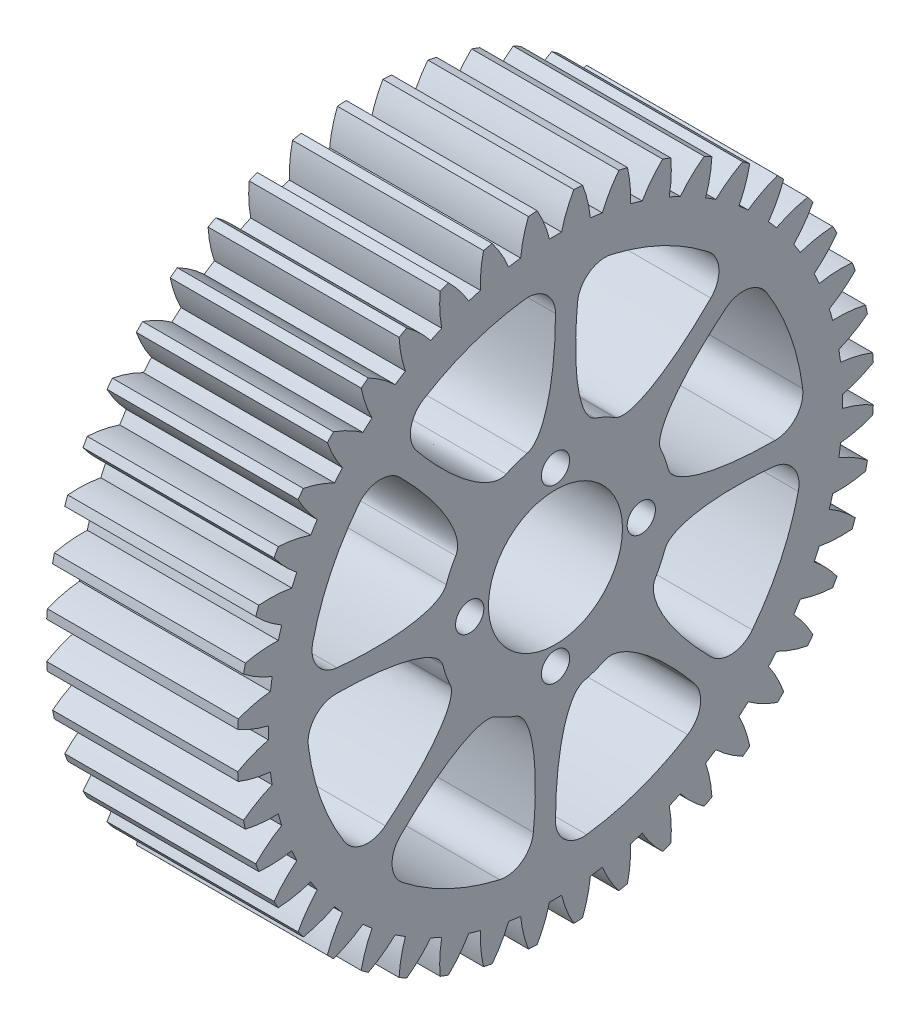
from build123d import *
from build123d.topology import SkipClean

# Parameters (mm, degrees)
BASPROSKE_W        = 44.5
BASPROSKE_H        = 57.5
TOOTHCUT_DEPTH     = 93.697087333
TEETHCUTS_COUNT    = 44
TEETHCUTS_ANGLE    = 351.818181818
HUBNEAONESKE_R     = 21
HUBNEARONE_DEPTH   = 5.5000508
BORSKE_R           = 12
BORE_DEPTH         = 50.0000508
CUT_EXTRUDE1_DEPTH = 93.578937397
FILLET4_R          = 5
SKETCH6_R          = 57.5
CUT_EXTRUDE2_DEPTH = 10
SKETCH7_R          = 12.1
CUT_EXTRUDE3_DEPTH = 91.502009572
SKETCH8_R          = 2.55
CUT_EXTRUDE4_DEPTH = 91.502009572
CIRPATTERN1_COUNT  = 4


with BuildPart() as part:
    # BasProSke → Base-Revolve (revolve)
    with BuildSketch(Plane(origin=(0, 0, 0), x_dir=(1, 0, 0), z_dir=(0, 1, 0)), mode=Mode.PRIVATE) as base_revolve_sk:
        with Locations((22.25, 28.75)):
            Rectangle(BASPROSKE_W, BASPROSKE_H)
    revolve(base_revolve_sk.sketch.rotate(Axis((-10, 0, 0), (1, 0, 0)), 180), axis=Axis((-10, 0, 0), (1, 0, 0)))

    # TooCutSke → ToothCut (cut, through all)
    with BuildSketch(Plane(origin=(0, 0, 0), x_dir=(0, 0, -1), z_dir=(1, 0, 0))):
        with BuildLine():
            ThreePointArc((1.096427316, 51.862411467), (0, 51.874), (-1.096427316, 51.862411467))
            ThreePointArc((-1.096427316, 51.862411467), (-2.018853505, 54.722077315), (-3.322337066, 57.429380299))
            ThreePointArc((-3.322337066, 57.429380299), (0, 57.5254), (3.322337066, 57.429380299))
            ThreePointArc((3.322337066, 57.429380299), (2.018853505, 54.722077315), (1.096427316, 51.862411467))
        make_face()
    toothcut = extrude(amount=TOOTHCUT_DEPTH, mode=Mode.SUBTRACT)

    # TeethCuts: ToothCut ×44 about axis
    teethcuts_axis = Axis((-10, 0, 0), (1, 0, 0))
    for i in range(1, TEETHCUTS_COUNT):
        add(toothcut.rotate(teethcuts_axis, i * TEETHCUTS_ANGLE / (TEETHCUTS_COUNT - 1)), mode=Mode.SUBTRACT)

    # HubNeaOneSke → HubNearOne (add)
    with BuildSketch(Plane.ZY):
        with Locations(Location((0, 0, 0), (0, 0, 180))):
            Circle(HUBNEAONESKE_R)
    extrude(amount=HUBNEARONE_DEPTH)

    # BorSke → Bore (cut, symmetric)
    with BuildSketch(Plane(origin=(0, 0, 0), x_dir=(0, 0, -1), z_dir=(1, 0, 0))):
        with Locations(Location((0, 0, 0), (0, 0, 180))):
            Circle(BORSKE_R)
    extrude(amount=BORE_DEPTH, both=True, mode=Mode.SUBTRACT)

    # Sketch5 → Cut-Extrude1 (cut, through all)
    with SkipClean():  # the faces are left unmerged after this step: merging them gives an invalid solid
        with BuildSketch(Plane.ZY):
            with BuildLine():
                Line((0, 21), (0, 45))
                ThreePointArc((0, 45), (15.100954119, 42.390578961), (28.450586133, 34.864941541))
                Line((28.450586133, 34.864941541), (13.276940195, 16.270306053))
                ThreePointArc((13.276940195, 16.270306053), (7.047111922, 19.782270182), (0, 21))
            make_face()
            with BuildLine():
                Line((14.849242405, 14.849242405), (31.819805153, 31.819805153))
                ThreePointArc((31.819805153, 31.819805153), (40.652652902, 19.296678782), (44.770838973, 4.535634206))
                Line((44.770838973, 4.535634206), (20.893058187, 2.116629296))
                ThreePointArc((20.893058187, 2.116629296), (18.971238021, 9.005116765), (14.849242405, 14.849242405))
            make_face()
            with BuildLine():
                Line((21, 0), (45, 0))
                ThreePointArc((45, 0), (42.390578961, -15.100954119), (34.864941541, -28.450586133))
                Line((34.864941541, -28.450586133), (16.270306053, -13.276940195))
                ThreePointArc((16.270306053, -13.276940195), (19.782270182, -7.047111922), (21, 0))
            make_face()
            with BuildLine():
                Line((14.849242405, -14.849242405), (31.819805153, -31.819805153))
                ThreePointArc((31.819805153, -31.819805153), (19.296678782, -40.652652902), (4.535634206, -44.770838973))
                Line((4.535634206, -44.770838973), (2.116629296, -20.893058187))
                ThreePointArc((2.116629296, -20.893058187), (9.005116765, -18.971238021), (14.849242405, -14.849242405))
            make_face()
            with BuildLine():
                Line((0, -21), (0, -45))
                ThreePointArc((0, -45), (-15.100954119, -42.390578961), (-28.450586133, -34.864941541))
                Line((-28.450586133, -34.864941541), (-13.276940195, -16.270306053))
                ThreePointArc((-13.276940195, -16.270306053), (-7.047111922, -19.782270182), (0, -21))
            make_face()
            with BuildLine():
                Line((-14.849242405, -14.849242405), (-31.819805153, -31.819805153))
                ThreePointArc((-31.819805153, -31.819805153), (-40.652652902, -19.296678782), (-44.770838973, -4.535634206))
                Line((-44.770838973, -4.535634206), (-20.893058187, -2.116629296))
                ThreePointArc((-20.893058187, -2.116629296), (-18.971238021, -9.005116765), (-14.849242405, -14.849242405))
            make_face()
            with BuildLine():
                Line((-21, 0), (-45, 0))
                ThreePointArc((-45, 0), (-42.390578961, 15.100954119), (-34.864941541, 28.450586133))
                Line((-34.864941541, 28.450586133), (-16.270306053, 13.276940195))
                ThreePointArc((-16.270306053, 13.276940195), (-19.782270182, 7.047111922), (-21, 0))
            make_face()
            with BuildLine():
                Line((-14.849242405, 14.849242405), (-31.819805153, 31.819805153))
                ThreePointArc((-31.819805153, 31.819805153), (-19.296678782, 40.652652902), (-4.535634206, 44.770838973))
                Line((-4.535634206, 44.770838973), (-2.116629296, 20.893058187))
                ThreePointArc((-2.116629296, 20.893058187), (-9.005116765, 18.971238021), (-14.849242405, 14.849242405))
            make_face()
        extrude(amount=-CUT_EXTRUDE1_DEPTH, mode=Mode.SUBTRACT)

    # Fillet2
    # a fillet whose section is not a circle: 20, 10 mm, written as the material it adds along each edge
    with BuildSketch(Plane(origin=(0, 2.116629296, 20.893058187), x_dir=(0, 0.10079187124910197, 0.9949075327336226), z_dir=(1, 0, 0)), Plane(origin=(0, -13.276940195, 16.270306053), x_dir=(0, -0.6322352474008042, 0.7747764786982396), z_dir=(1, 0, 0)), Plane(origin=(0, -20.893058187, 2.116629296), x_dir=(0, -0.9949075327336241, 0.10079187124908878), z_dir=(1, 0, 0)), Plane(origin=(0, -16.270306053, -13.276940195), x_dir=(0, -0.7747764786982538, -0.6322352474007871), z_dir=(1, 0, 0)), Plane(origin=(0, -2.116629296, -20.893058187), x_dir=(0, -0.10079187124909242, -0.9949075327336238), z_dir=(1, 0, 0)), Plane(origin=(0, 13.276940195, -16.270306053), x_dir=(0, 0.6322352474008044, -0.7747764786982396), z_dir=(1, 0, 0)), Plane(origin=(0, 20.893058187, -2.116629296), x_dir=(0, 0.9949075327336232, -0.1007918712490965), z_dir=(1, 0, 0)), Plane(origin=(0, 16.270306053, 13.276940195), x_dir=(0, 0.7747764786982432, 0.6322352474008002), z_dir=(1, 0, 0))) as fillet2_piece_1:
        with BuildLine():
            Bezier((18.761790704, 0), (0.65395433, 0), (-0.634204761, -5.12195122), weights=[1, 0.78863884, 1])
            ThreePointArc((-0.634204761, -5.12195122), (-0.159154288, -2.580532889), (0, 0))
            Line((0, 0), (18.761790704, 0))
        make_face()
    extrude(amount=44.5)

    # Fillet3
    # a fillet whose section is not a circle: 20, 10 mm, written as the material it adds along each edge
    with BuildSketch(Plane(origin=(0, 14.849242405, -14.849242405), x_dir=(0, 0.7071067811865472, -0.7071067811865478), z_dir=(1, 0, 0)), Plane(origin=(0, 21, 0), x_dir=(0, 1, 0), z_dir=(1, 0, 0)), Plane(origin=(0, 14.849242405, 14.849242405), x_dir=(0, 0.7071067811865478, 0.7071067811865472), z_dir=(1, 0, 0)), Plane(origin=(0, 0, 21), x_dir=(0, 0, 1), z_dir=(1, 0, 0)), Plane(origin=(0, -14.849242405, 14.849242405), x_dir=(0, -0.7071067811865472, 0.7071067811865478), z_dir=(1, 0, 0)), Plane(origin=(0, -21, 0), x_dir=(0, -1, 0), z_dir=(1, 0, 0)), Plane(origin=(0, -14.849242405, -14.849242405), x_dir=(0, -0.7071067811865479, -0.7071067811865472), z_dir=(1, 0, 0)), Plane(origin=(0, 0, -21), x_dir=(0, 0, -1), z_dir=(1, 0, 0))) as fillet3_piece_1:
        with BuildLine():
            Bezier((18.761790704, 0), (0.65395433, 0), (-0.634204761, 5.12195122), weights=[1, 0.78863884, 1])
            ThreePointArc((-0.634204761, 5.12195122), (-0.159154288, 2.580532889), (0, 0))
            Line((0, 0), (18.761790704, 0))
        make_face()
    extrude(amount=44.5)

    # Fillet4
    fillet4_edges = [part.edges().sort_by_distance(p)[0] for p in [
        (22.25, 31.819805153, 31.819805153),
        (22.25, 0, 45),
        (22.25, -28.450586133, 34.864941541),
        (22.25, -31.819805153, 31.819805153),
        (22.25, -44.770838973, 4.535634206),
        (22.25, -45, 0),
        (22.25, -34.864941541, -28.450586133),
        (22.25, -31.819805153, -31.819805153),
        (22.25, -4.535634206, -44.770838973),
        (22.25, 0, -45),
        (22.25, 28.450586133, -34.864941541),
        (22.25, 31.819805153, -31.819805153),
        (22.25, 45, 0),
        (22.25, 44.770838973, -4.535634206),
        (22.25, 34.864941541, 28.450586133),
        (22.25, 4.535634206, 44.770838973),
    ]]
    fillet(fillet4_edges, radius=FILLET4_R)

    # Sketch6 → Cut-Extrude2 (cut)
    with BuildSketch(Plane(origin=(44.5, 0, 0), x_dir=(0, 0, -1), z_dir=(1, 0, 0))):
        Circle(SKETCH6_R)
    extrude(amount=-CUT_EXTRUDE2_DEPTH, mode=Mode.SUBTRACT)

    # Sketch7 → Cut-Extrude3 (cut, through all)
    with BuildSketch(Plane(origin=(34.5, 0, 0), x_dir=(0, 0, -1), z_dir=(1, 0, 0))):
        Circle(SKETCH7_R)
    extrude(amount=-CUT_EXTRUDE3_DEPTH, mode=Mode.SUBTRACT)

    # Sketch8 → Cut-Extrude4 (cut, through all)
    with BuildSketch(Plane(origin=(34.5, 0, 0), x_dir=(0, 0, -1), z_dir=(1, 0, 0))):
        with Locations((0, 15.5)):
            Circle(SKETCH8_R)
    cut_extrude4 = extrude(amount=-CUT_EXTRUDE4_DEPTH, mode=Mode.SUBTRACT)

    # CirPattern1: Cut-Extrude4 ×4 about axis
    cirpattern1_axis = Axis((0, 0, 0), (1, 0, 0))
    for i in range(1, CIRPATTERN1_COUNT):
        add(cut_extrude4.rotate(cirpattern1_axis, i * 360 / CIRPATTERN1_COUNT), mode=Mode.SUBTRACT)


solid = part.part
